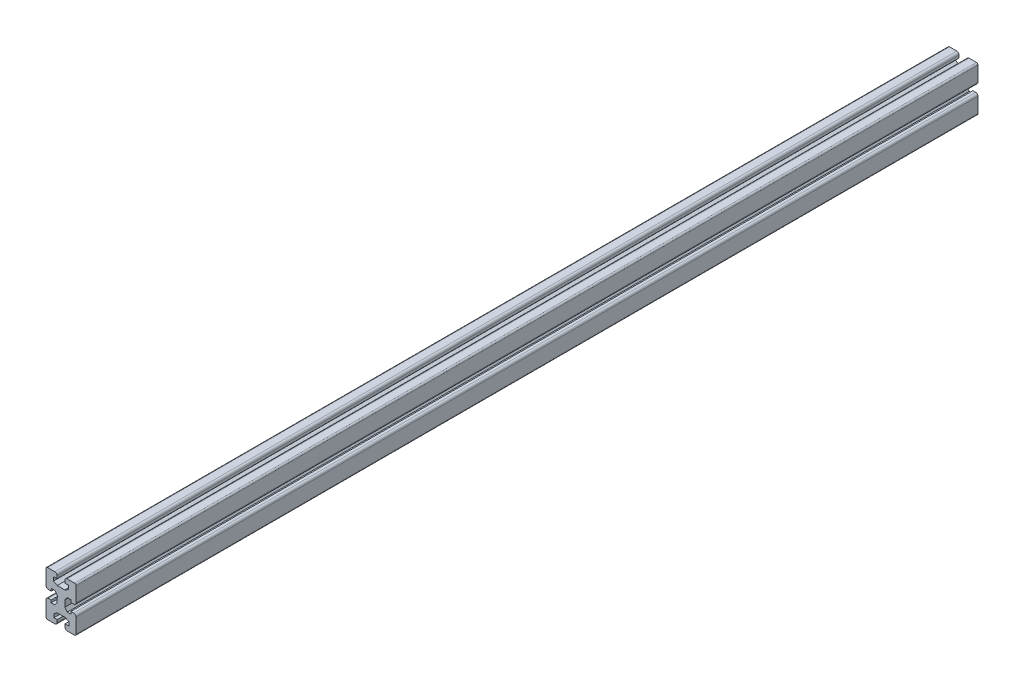
from build123d import *

# Parameters (mm, degrees)
SALIENTE_EXTRUIR1_DEPTH = 1200
REDONDEO3_R             = 2
REDONDEO4_R             = 3
CORTAR_EXTRUIR1_DEPTH   = 1200


with BuildPart() as part:
    # Croquis1 → Saliente-Extruir1 (new body)
    with BuildSketch(Plane.XY):
        Polygon((20, -30), (5.2, -30), (5.2, -20), (-5.2, -20), (-5.2, -30), (-20, -30), (-20, -5), (-10, -5), (-10, 5.215), (-20, 5.215), (-20, 30), (-5.2, 30), (-5.2, 20), (5.2, 20), (5.2, 30), (20, 30), (20, 5.215), (10, 5.215), (10, -5), (20, -5), align=None)
    extrude(amount=SALIENTE_EXTRUIR1_DEPTH)

    # Redondeo3
    redondeo3_edges = [part.edges().sort_by_distance(p)[0] for p in [
        (-20, -30, 600),
        (20, -30, 600),
        (20, 30, 600),
        (-20, 30, 600),
    ]]
    fillet(redondeo3_edges, radius=REDONDEO3_R)

    # Redondeo4
    redondeo4_edges = [part.edges().sort_by_distance(p)[0] for p in [
        (5.2, 30, 600),
        (20, -5, 600),
        (20, 5.215, 600),
        (-5.2, 30, 600),
        (-20, -5, 600),
        (-20, 5.215, 600),
        (5.2, -30, 600),
        (-5.2, -30, 600),
    ]]
    fillet(redondeo4_edges, radius=REDONDEO4_R)

    # Croquis2 → Cortar-Extruir1 (cut)
    with BuildSketch(Plane.XY.offset(1200)):
        Polygon((-10, 23.452026666), (-10, 18.452026666), (-5, 15.75606021), (5, 15.75606021), (10, 18.452026666), (10, 23.452026666), align=None)
        Polygon((-4.660128357, -15.859906589), (-9.601016284, -18.662737591), (-9.493528706, -23.6615821), (10.501849328, -23.231631786), (10.39436175, -18.232787277), (5.33756066, -15.644931432), align=None)
        Polygon((13, 8.477670191), (8.105479793, 8.477670191), (5, 4.292585096), (5.091124424, -4.184105508), (8.285855478, -8.301463337), (13.17924457, -8.196243312), align=None)
        Polygon((-8.105479793, 8.477670191), (-13, 8.477670191), (-13.17924457, -8.196243312), (-8.285855478, -8.301463337), (-5.091124424, -4.184105508), (-5, 4.292585096), align=None)
    extrude(amount=-CORTAR_EXTRUIR1_DEPTH, mode=Mode.SUBTRACT)


solid = part.part
